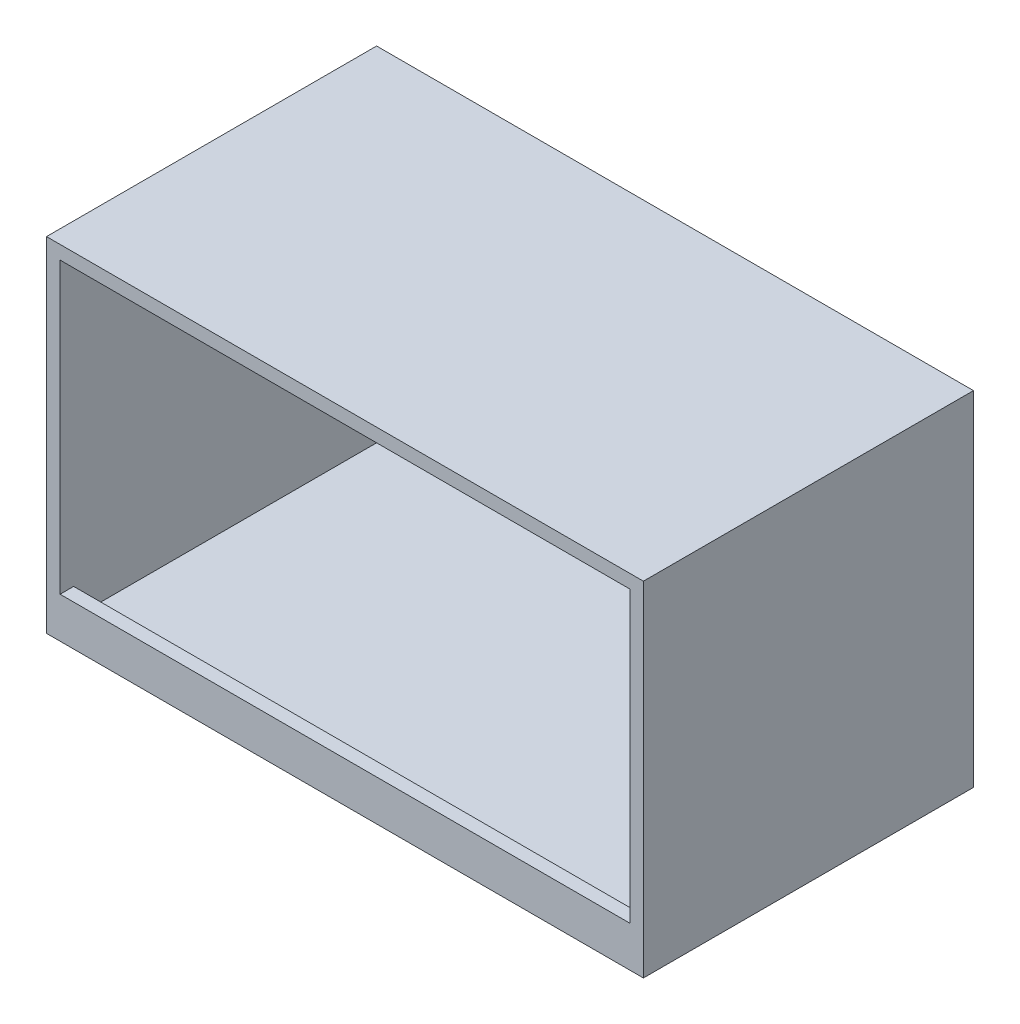
from build123d import *

# Parameters (mm, degrees)
SKETCH_1_W      = 66
SKETCH_1_H      = 38
EXTRUDE_1_DEPTH = 1.5
SKETCH_2_W      = 66
SKETCH_2_H      = 38
SKETCH_2_W_2    = 63
SKETCH_2_H_2    = 35
EXTRUDE_2_DEPTH = 35
SKETCH_3_W      = 63
SKETCH_3_H      = 1.5
EXTRUDE_3_DEPTH = 3
FILLET_1_R      = 3


with BuildPart() as part:
    # 草图1 → 凸台-拉伸1 (new body)
    with BuildSketch(Plane.XY):
        with Locations((33, -19)):
            Rectangle(SKETCH_1_W, SKETCH_1_H)
    extrude(amount=EXTRUDE_1_DEPTH)

    # 草图2 → 凸台-拉伸2 (add)
    with BuildSketch(Plane.XY.offset(1.5)):
        with Locations((33, -19)):
            Rectangle(SKETCH_2_W, SKETCH_2_H)
        with Locations((33, -19)):
            Rectangle(SKETCH_2_W_2, SKETCH_2_H_2, mode=Mode.SUBTRACT)
    extrude(amount=EXTRUDE_2_DEPTH)

    # 草图3 → 凸台-拉伸3 (add)
    with BuildSketch(Plane(origin=(0, -36.5, 0), x_dir=(1, 0, 0), z_dir=(0, 1, 0))):
        with Locations((33, -35.75)):
            Rectangle(SKETCH_3_W, SKETCH_3_H)
    extrude(amount=EXTRUDE_3_DEPTH)

    # 圆角1
    fillet_1_edges = [part.edges().sort_by_distance(p)[0] for p in [
        (33, -36.5, 35),
    ]]
    fillet(fillet_1_edges, radius=FILLET_1_R - 0.0001)  # a hair under: the kernel refuses the full size


solid = part.part
